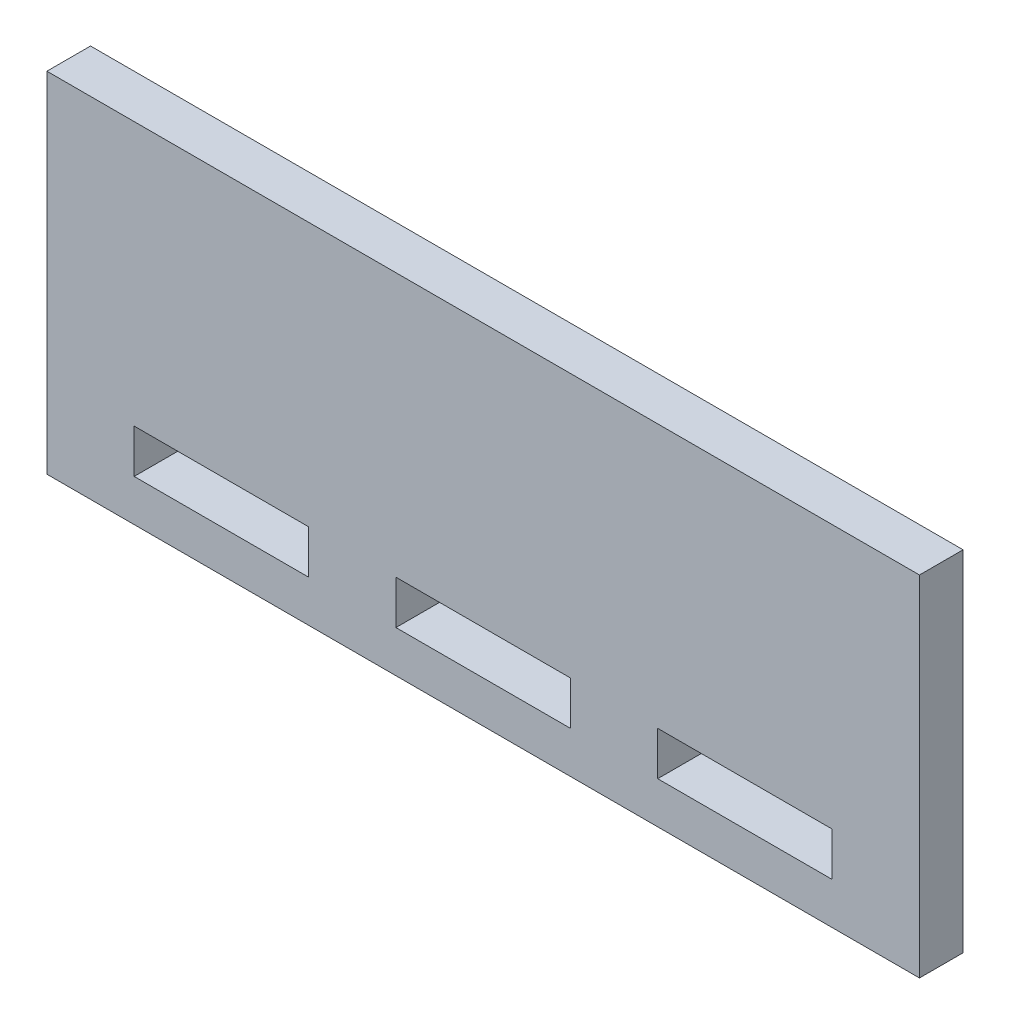
from build123d import *

# Parameters (mm, degrees)
SKETCH1_W           = 127
SKETCH1_H           = 6.35
BOSS_EXTRUDE1_DEPTH = 50.8
SKETCH4_W           = 25.4
SKETCH4_H           = 6.35
CUT_EXTRUDE2_DEPTH  = 82.567226875


with BuildPart() as part:
    # Sketch1 → Boss-Extrude1 (new body)
    with BuildSketch(Plane(origin=(0, 0, 0), x_dir=(1, 0, 0), z_dir=(0, 1, 0))):
        Rectangle(SKETCH1_W, SKETCH1_H)
    extrude(amount=BOSS_EXTRUDE1_DEPTH)

    # Sketch4 → Cut-Extrude2 (cut, through all)
    with BuildSketch(Plane.XY.offset(3.175)):
        with Locations((-38.1, 9.244769645)):
            Rectangle(SKETCH4_W, SKETCH4_H)
        with Locations((0, 9.244769645)):
            Rectangle(SKETCH4_W, SKETCH4_H)
        with Locations((38.1, 9.244769645)):
            Rectangle(SKETCH4_W, SKETCH4_H)
    extrude(amount=-CUT_EXTRUDE2_DEPTH, mode=Mode.SUBTRACT)


solid = part.part
